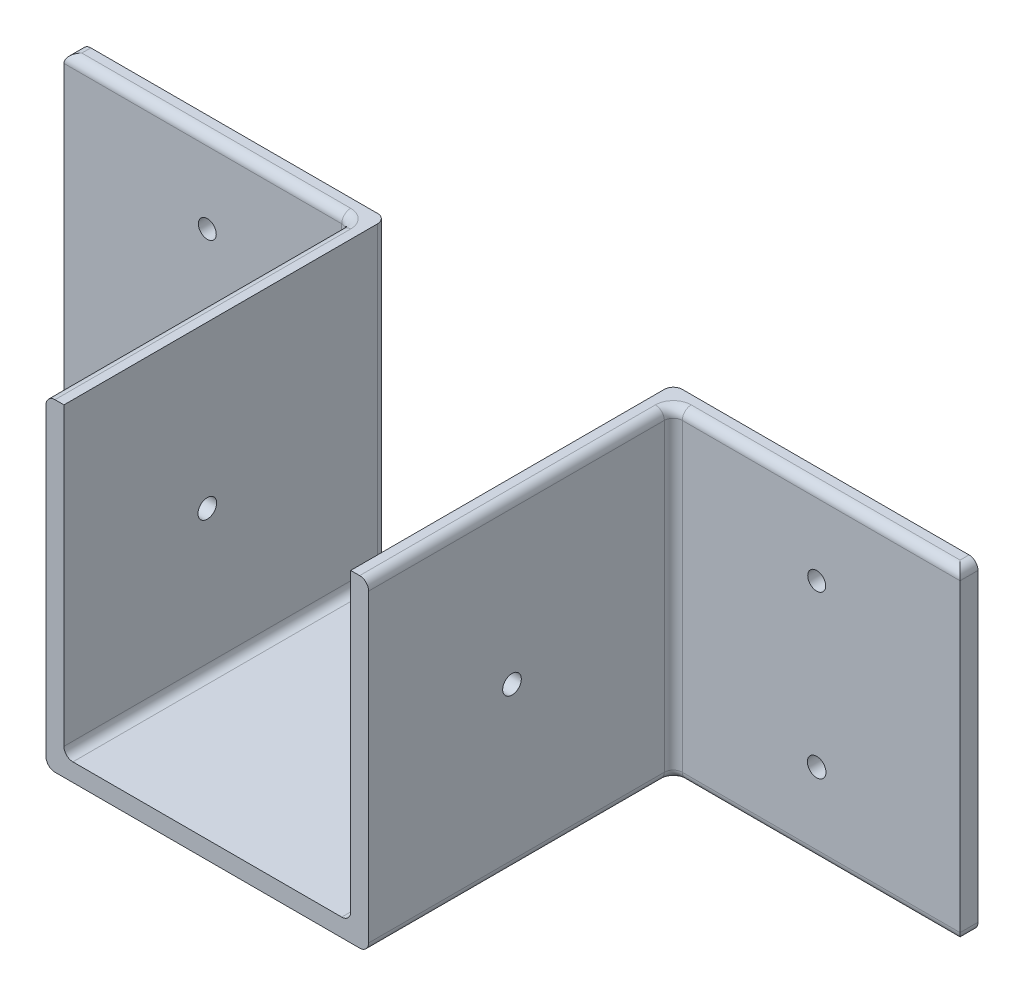
from build123d import *

# Parameters (mm, degrees)
BOSS_EXTRUDE1_DEPTH  = 57.15
SKETCH1_3_W          = 50.8
SKETCH1_3_H          = 57.15
SKETCH1_3_R          = 1.651
SKETCH1_3_R_2        = 1.5875
BOSS_EXTRUDE2_DEPTH  = 3.175
SKETCH2_R            = 1.651
CUT_EXTRUDE1_DEPTH   = 3.175
FILLET1_R            = 1.5875
FILLET1_OF_MIRROR1_R = 1.5875


with BuildPart() as part:
    # Sketch1 → Boss-Extrude1 (new body)
    with BuildSketch(Plane.XY):
        Polygon((-28.575, 0), (0, 0), (0, 3.175), (-25.4, 3.175), (-25.4, 53.975), (-25.4, 57.15), (-28.575, 57.15), align=None)
    boss_extrude1 = extrude(amount=BOSS_EXTRUDE1_DEPTH)

    # Sketch1<3> → Boss-Extrude2 (add)
    with BuildSketch(Plane.XY):
        with Locations((-53.975, 28.575)):
            Rectangle(SKETCH1_3_W, SKETCH1_3_H)
        with Locations((-53.975, 14.2875)):
            Circle(SKETCH1_3_R, mode=Mode.SUBTRACT)
        with Locations((-53.975, 42.8625)):
            Circle(SKETCH1_3_R_2, mode=Mode.SUBTRACT)
    boss_extrude2 = extrude(amount=BOSS_EXTRUDE2_DEPTH)

    # Sketch2 → Cut-Extrude1 (cut)
    with BuildSketch(Plane.ZY.offset(28.575)):
        with Locations((31.75, 28.575)):
            Circle(SKETCH2_R)
    cut_extrude1 = extrude(amount=-CUT_EXTRUDE1_DEPTH, mode=Mode.SUBTRACT)

    # Fillet1
    fillet1_edges = [part.edges().sort_by_distance(p)[0] for p in [
        (-25.4, 30.1625, 0),
        (-25.4, 3.175, 28.575),
        (-28.575, 0, 30.1625),
        (-28.575, 57.15, 30.1625),
        (-53.975, 0, 3.175),
        (-79.375, 0, 1.5875),
        (-79.375, 57.15, 1.5875),
        (-28.575, 28.575, 3.175),
        (-53.975, 57.15, 3.175),
        (-12.7, 3.175, 0),
    ]]
    fillet(fillet1_edges, radius=FILLET1_R - 0.0001)  # a hair under: the kernel refuses the full size

    # Mirror1: Boss-Extrude1, Boss-Extrude2, Cut-Extrude1 across plane
    add(boss_extrude1.mirror(Plane(origin=(0, 0, 0), x_dir=(0, 0, 1), z_dir=(1, 0, 0))))
    add(boss_extrude2.mirror(Plane(origin=(0, 0, 0), x_dir=(0, 0, 1), z_dir=(1, 0, 0))))
    add(cut_extrude1.mirror(Plane(origin=(0, 0, 0), x_dir=(0, 0, 1), z_dir=(1, 0, 0))), mode=Mode.SUBTRACT)

    # Fillet1 of Mirror1
    fillet1_of_mirror1_edges = [part.edges().sort_by_distance(p)[0] for p in [
        (25.4, 30.1625, 0),
        (25.4, 3.175, 28.575),
        (28.575, 0, 30.1625),
        (28.575, 57.15, 30.1625),
        (53.975, 0, 3.175),
        (79.375, 0, 1.5875),
        (79.375, 57.15, 1.5875),
        (28.575, 28.575, 3.175),
        (53.975, 57.15, 3.175),
        (12.7, 3.175, 0),
    ]]
    fillet(fillet1_of_mirror1_edges, radius=FILLET1_OF_MIRROR1_R - 0.0001)  # a hair under: the kernel refuses the full size


solid = part.part
